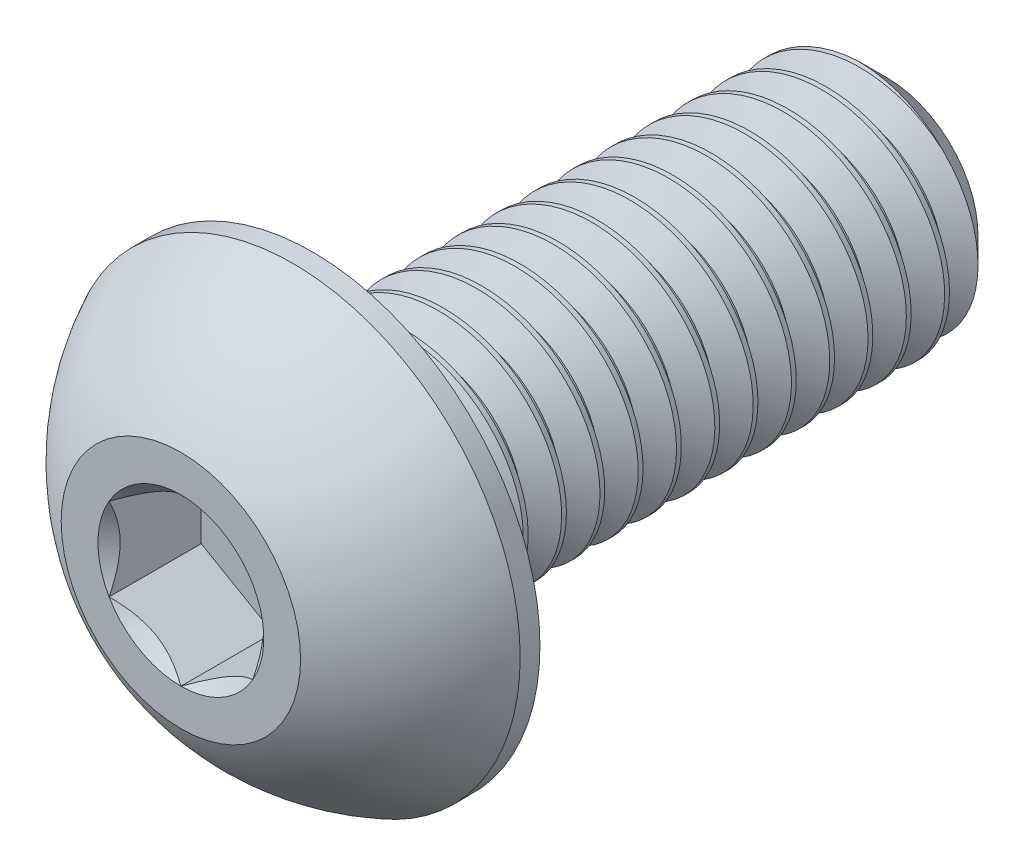
from build123d import *

# Parameters (mm, degrees)
SKETCH1_W          = 12
SKETCH1_H          = 2.5
CHAMFER1_SIZE      = 0.6
CUT_EXTRUDE2_DEPTH = 1.925
CUT_SWEEP1_PITCH   = 0.8


with BuildPart() as part:
    # Sketch1 → Revolve1 (revolve)
    with BuildSketch(Plane(origin=(0, 0, 0), x_dir=(0, 0, -1), z_dir=(1, 0, 0))):
        with Locations((8.75, 1.25)):
            Rectangle(SKETCH1_W, SKETCH1_H)
    revolve(axis=Axis((0, 0, -14.75), (0, 0, 1)))

    # Chamfer1
    chamfer1_edges = [part.edges().sort_by_distance(p)[0] for p in [
        (0, -2.5, -14.75),
    ]]
    chamfer(chamfer1_edges, length=CHAMFER1_SIZE)

    # Sketch7 → Revolve2 (revolve)
    with BuildSketch(Plane(origin=(0, 0, 0), x_dir=(0, 0, -1), z_dir=(1, 0, 0)), mode=Mode.PRIVATE) as revolve2_sk:
        with BuildLine():
            Line((2.3375, 4.75), (2.75, 4.75))
            Line((2.75, 4.75), (2.75, 0))
            Line((2.75, 0), (0, 0))
            Line((0, 0), (0, 2.5))
            ThreePointArc((0, 2.5), (0.991875183, 3.808753282), (2.3375, 4.75))
        make_face()
    revolve(revolve2_sk.sketch.rotate(Axis((0, 0, 0), (0, 0, -1)), 180), axis=Axis((0, 0, 0), (0, 0, -1)))

    # Sketch5 → Cut-Extrude2 (cut)
    with BuildSketch(Plane.XY):
        Polygon((1.5, -0.866025404), (1.5, 0.866025404), (0, 1.732050808), (-1.5, 0.866025404), (-1.5, -0.866025404), (0, -1.732050808), align=None)
    extrude(amount=-CUT_EXTRUDE2_DEPTH, mode=Mode.SUBTRACT)

    # Cut-Extrude3 cone 1 section (through the dimple's axis) → Cut-Extrude3 (revolve, cut)
    with BuildSketch(Plane(origin=(0, 0, 0), x_dir=(0, -1, 0), z_dir=(1, 0, 0))):
        Polygon((0, 0), (1.732050808, 0), (0, 1.732050808), align=None)
    revolve(axis=Axis((0, 0, 0), (0, 0, -1)), mode=Mode.SUBTRACT)

    # Cut-Sweep1: the profile of Sketch2 profile screwed along a right-hand helix of 16 turns, 8 arcs to a turn; built about Z, then put on its axis
    cut_sweep1_z = Axis((0, 0, 0), (0, 0, 1))
    cut_sweep1_corners = [(2.5003, 0, 0.600173205), (2.5003, 0, -0.100173205), (1.980384758, 0, 0.2), (1.980384758, 0, 0.3)]
    with BuildLine(mode=Mode.PRIVATE) as cut_sweep1_profile:
        Line(cut_sweep1_corners[0], cut_sweep1_corners[1])
        Line(cut_sweep1_corners[1], cut_sweep1_corners[2])
        Line(cut_sweep1_corners[2], cut_sweep1_corners[3])
        Line(cut_sweep1_corners[3], cut_sweep1_corners[0])
    cut_sweep1_cap = Face(cut_sweep1_profile.wire())
    cut_sweep1_turn_angles = [0, 22.5, 45, 67.5, 90, 112.5, 135, 157.5, 180, 202.5, 225, 247.5, 270, 292.5, 315, 337.5, 360]
    cut_sweep1_turn_weights = [1, 0.9238795325112867, 1, 0.9238795325112867, 1, 0.9238795325112867, 1, 0.9238795325112867, 1, 0.9238795325112867, 1, 0.9238795325112867, 1, 0.9238795325112867, 1, 0.9238795325112867, 1]
    cut_sweep1_turn_rails = [Edge.make_bspline([Vector(p[0], p[1], 0).rotate(cut_sweep1_z, cut_sweep1_turn_angles[k]) / cut_sweep1_turn_weights[k] + Vector(0, 0, p[2] + CUT_SWEEP1_PITCH * cut_sweep1_turn_angles[k] / 360) for k in range(17)], [0, 0, 0, 1, 1, 2, 2, 3, 3, 4, 4, 5, 5, 6, 6, 7, 7, 8, 8, 8], 2, cut_sweep1_turn_weights) for p in cut_sweep1_corners]
    cut_sweep1_turn_sides = [Face.make_surface_from_curves(cut_sweep1_turn_rails[p[0]], cut_sweep1_turn_rails[p[1]]) for p in [(0, 1), (1, 2), (2, 3), (3, 0)]]
    cut_sweep1 = Plane(origin=(0, 0, -14.75), x_dir=(0, 1, 0), z_dir=(0, 0, 1)) * Solid(Shell([*[p.moved(Location((0, 0, CUT_SWEEP1_PITCH * i))) for i in range(16) for p in cut_sweep1_turn_sides], cut_sweep1_cap, cut_sweep1_cap.rotate(cut_sweep1_z, 5760).moved(Location((0, 0, CUT_SWEEP1_PITCH * 5760 / 360)))]))
    add(cut_sweep1, mode=Mode.SUBTRACT)


solid = part.part
